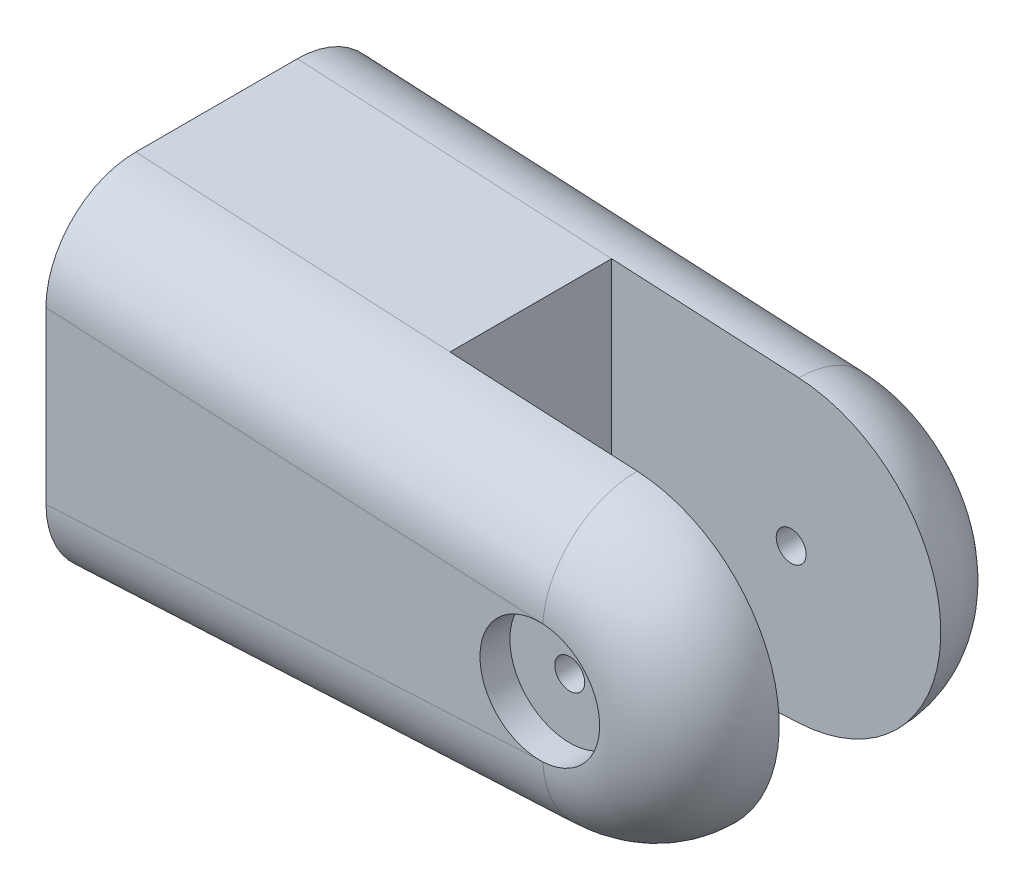
from build123d import *

# Parameters (mm, degrees)
BOSS_EXTRUDE1_DEPTH     = 57
SKETCH2_R               = 37.5
BOSS_EXTRUDE2_DEPTH     = 2
CUT_EXTRUDE1_DEPTH      = 186.90387301
CUT_EXTRUDE1_DEPTH_BACK = 186.90387301
FILLET2_R               = 30
SKETCH5_R               = 20
CUT_EXTRUDE2_DEPTH      = 10
SKETCH6_R               = 5
CUT_EXTRUDE3_DEPTH      = 500


with BuildPart() as part:
    # Sketch1 → Boss-Extrude1 (new, symmetric)
    with BuildSketch(Plane.XY):
        with BuildLine():
            Line((-165, -58.5), (-165, 58.5))
            Line((-165, 58.5), (2.552640416, 49.934797756))
            ThreePointArc((2.552640416, 49.934797756), (50, 0), (2.552640416, -49.934797756))
            Line((2.552640416, -49.934797756), (-165, -58.5))
        make_face()
    extrude(amount=BOSS_EXTRUDE1_DEPTH, both=True)

    # Sketch2 → Boss-Extrude2 (add)
    with BuildSketch(Plane.ZY.offset(165)):
        Circle(SKETCH2_R)
    extrude(amount=BOSS_EXTRUDE2_DEPTH)

    # Sketch3 → Cut-Extrude1 (cut, two sides: drawn at the far end of the back side and taken through both)
    with BuildSketch(Plane(origin=(0, 0, 0), x_dir=(1, 0, 0), z_dir=(0, 1, 0)).offset(-CUT_EXTRUDE1_DEPTH_BACK)):
        Polygon((50, -27), (50, 0), (50, 27), (-60, 27), (-60, -27), align=None)
    extrude(amount=CUT_EXTRUDE1_DEPTH + CUT_EXTRUDE1_DEPTH_BACK, mode=Mode.SUBTRACT)

    # Fillet2
    fillet2_edges = [part.edges().sort_by_distance(p)[0] for p in [
        (-81.223679792, -54.217398878, 57),
        (-81.223679792, -54.217398878, -57),
        (50, 0, -57),
        (-81.223679792, 54.217398878, -57),
        (-81.223679792, 54.217398878, 57),
        (50, 0, 57),
    ]]
    fillet(fillet2_edges, radius=FILLET2_R - 0.0001)  # a hair under: the kernel refuses the full size

    # Sketch5 → Cut-Extrude2 (cut)
    with BuildSketch(Plane(origin=(0, 0, -57), x_dir=(-1, 0, 0), z_dir=(0, 0, -1))):
        Circle(SKETCH5_R)
    cut_extrude2 = extrude(amount=-CUT_EXTRUDE2_DEPTH, mode=Mode.SUBTRACT)

    # Mirror1: Cut-Extrude2 across plane
    add(cut_extrude2.mirror(Plane.XY), mode=Mode.SUBTRACT)

    # Sketch6 → Cut-Extrude3 (cut)
    with BuildSketch(Plane(origin=(0, 0, -47), x_dir=(-1, 0, 0), z_dir=(0, 0, -1))):
        with Locations(Location((0, 0, 0), (0, 0, 180))):
            Circle(SKETCH6_R)
    extrude(amount=-CUT_EXTRUDE3_DEPTH, mode=Mode.SUBTRACT)


solid = part.part
